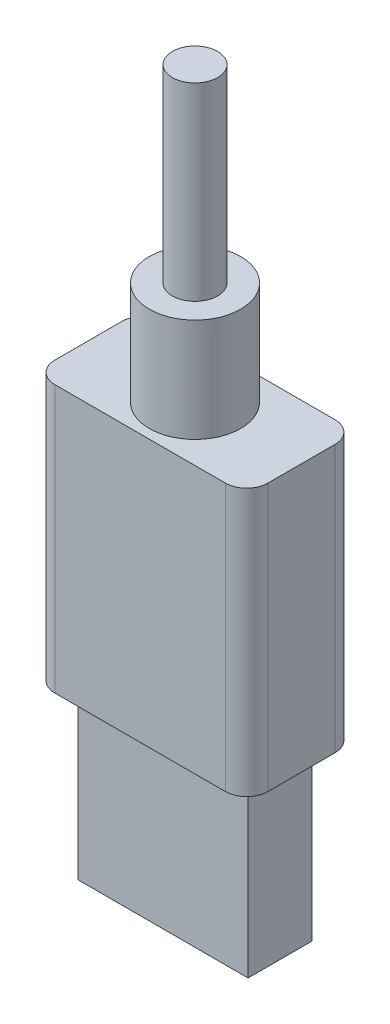
from build123d import *

# Parameters (mm, degrees)
SKETCH1_W           = 12
SKETCH1_H           = 4.5
BOSS_EXTRUDE1_DEPTH = 12.23
BOSS_EXTRUDE2_DEPTH = 18.87
SKETCH3_R           = 3.225
BOSS_EXTRUDE3_DEPTH = 7.3
SKETCH4_R           = 1.6
BOSS_EXTRUDE4_DEPTH = 13.36


with BuildPart() as part:
    # Sketch1 → Boss-Extrude1 (new body)
    with BuildSketch(Plane(origin=(0, 0, 0), x_dir=(1, 0, 0), z_dir=(0, 1, 0))):
        Rectangle(SKETCH1_W, SKETCH1_H)
    extrude(amount=BOSS_EXTRUDE1_DEPTH)

    # Sketch2 → Boss-Extrude2 (add)
    with BuildSketch(Plane(origin=(0, 12.23, 0), x_dir=(1, 0, 0), z_dir=(0, 1, 0))):
        with BuildLine():
            Line((-6.025, -3.875), (6.025, -3.875))
            ThreePointArc((6.025, -3.875), (7.085660172, -3.435660172), (7.525, -2.375))
            Line((7.525, -2.375), (7.525, 2.375))
            ThreePointArc((7.525, 2.375), (7.085660172, 3.435660172), (6.025, 3.875))
            Line((6.025, 3.875), (-6.025, 3.875))
            ThreePointArc((-6.025, 3.875), (-7.085660172, 3.435660172), (-7.525, 2.375))
            Line((-7.525, 2.375), (-7.525, -2.375))
            ThreePointArc((-7.525, -2.375), (-7.085660172, -3.435660172), (-6.025, -3.875))
        make_face()
    extrude(amount=BOSS_EXTRUDE2_DEPTH)

    # Sketch3 → Boss-Extrude3 (add)
    with BuildSketch(Plane(origin=(0, 31.1, 0), x_dir=(1, 0, 0), z_dir=(0, 1, 0))):
        Circle(SKETCH3_R)
    extrude(amount=BOSS_EXTRUDE3_DEPTH)

    # Sketch4 → Boss-Extrude4 (add)
    with BuildSketch(Plane(origin=(0, 38.4, 0), x_dir=(1, 0, 0), z_dir=(0, 1, 0))):
        Circle(SKETCH4_R)
    extrude(amount=BOSS_EXTRUDE4_DEPTH)


solid = part.part
